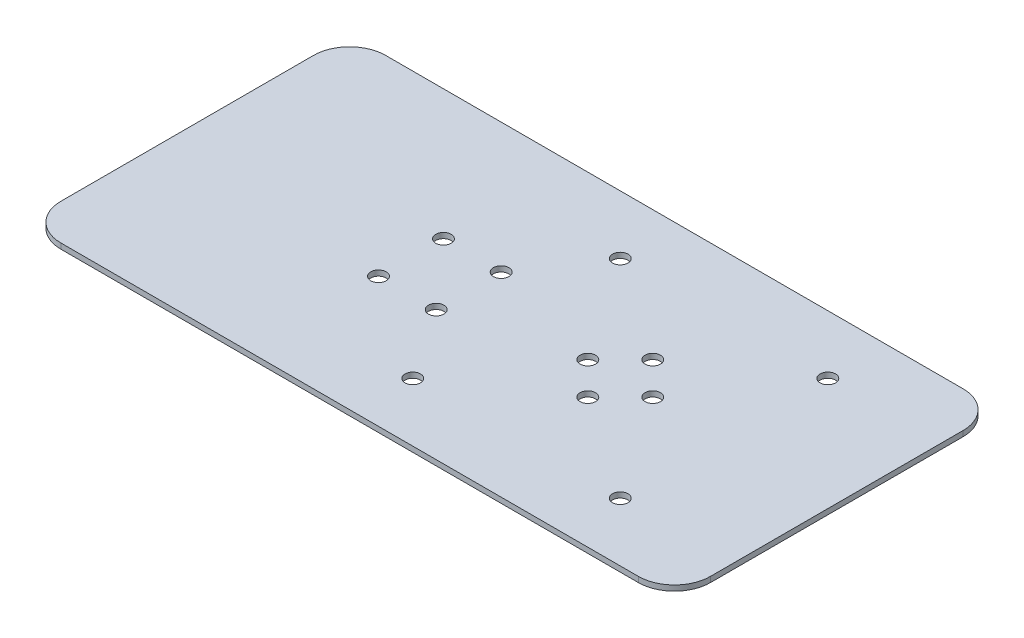
from build123d import *

# Parameters (mm, degrees)
SKETCH1_W           = 180
SKETCH1_H           = 120
BOSS_EXTRUDE1_DEPTH = 1.5
SKETCH2_R           = 2.15
CUT_EXTRUDE1_DEPTH  = 217.33827678
SKETCH3_W           = 180
SKETCH3_H           = 15
CUT_EXTRUDE2_DEPTH  = 217.33827678
FILLET1_R           = 10


with BuildPart() as part:
    # Sketch1 → Boss-Extrude1 (new body)
    with BuildSketch(Plane(origin=(0, 0, 0), x_dir=(1, 0, 0), z_dir=(0, 1, 0))):
        with Locations((90, -60)):
            Rectangle(SKETCH1_W, SKETCH1_H)
    extrude(amount=BOSS_EXTRUDE1_DEPTH)

    # Sketch2 → Cut-Extrude1 (cut, through all)
    with BuildSketch(Plane(origin=(0, 1.5, 0), x_dir=(1, 0, 0), z_dir=(0, 1, 0))):
        with Locations((120, -51)):
            Circle(SKETCH2_R)
        with Locations((120, -69)):
            Circle(SKETCH2_R)
        with Locations((129, -60)):
            Circle(SKETCH2_R)
        with Locations((111, -60)):
            Circle(SKETCH2_R)
        with Locations((78, -51)):
            Circle(SKETCH2_R)
        with Locations((62, -51)):
            Circle(SKETCH2_R)
        with Locations((62, -69)):
            Circle(SKETCH2_R)
        with Locations((78, -69)):
            Circle(SKETCH2_R)
        with Locations((148.75, -31.25)):
            Circle(SKETCH2_R)
        with Locations((91.25, -31.25)):
            Circle(SKETCH2_R)
        with Locations((91.25, -88.75)):
            Circle(SKETCH2_R)
        with Locations((148.75, -88.75)):
            Circle(SKETCH2_R)
    extrude(amount=-CUT_EXTRUDE1_DEPTH, mode=Mode.SUBTRACT)

    # Sketch3 → Cut-Extrude2 (cut, through all)
    with BuildSketch(Plane(origin=(0, 1.5, 0), x_dir=(1, 0, 0), z_dir=(0, 1, 0))):
        with Locations((90, -7.5)):
            Rectangle(SKETCH3_W, SKETCH3_H)
        with Locations((90, -112.5)):
            Rectangle(SKETCH3_W, SKETCH3_H)
    extrude(amount=-CUT_EXTRUDE2_DEPTH, mode=Mode.SUBTRACT)

    # Fillet1
    fillet1_edges = [part.edges().sort_by_distance(p)[0] for p in [
        (0, 0.75, 15),
        (180, 0.75, 15),
        (180, 0.75, 105),
        (0, 0.75, 105),
    ]]
    fillet(fillet1_edges, radius=FILLET1_R)


solid = part.part
